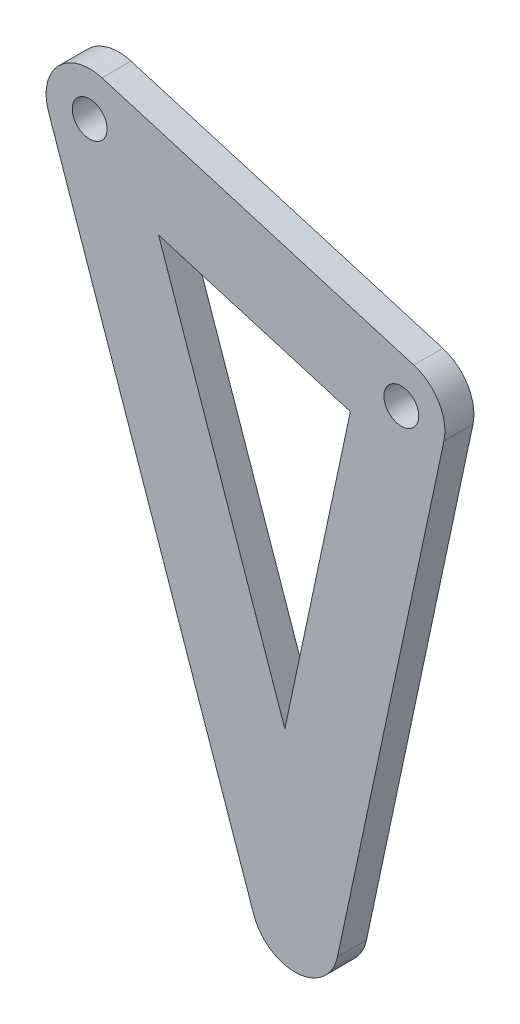
from build123d import *

# Parameters (mm, degrees)
BOSS_EXTRU_1_DEPTH           = 5
ENL_V_MAT_EXTRU_1_DEPTH      = 209.982344461
ENL_V_MAT_EXTRU_1_DEPTH_BACK = 209.982344461
ESQUISSE2_R                  = 3


with BuildPart() as part:
    # Esquisse1 → Boss.-Extru.1 (new body)
    with BuildSketch(Plane.XY):
        with BuildLine():
            ThreePointArc((-136.168332206, -32.884009695), (-143.727587426, -34.88617621), (-145.396458882, -42.525932639))
            Line((-145.396458882, -42.525932639), (-110.058903202, -144.581099871))
            ThreePointArc((-110.058903202, -144.581099871), (-102.508982864, -149.612813131), (-95.636285785, -143.689514194))
            Line((-95.636285785, -143.689514194), (-77.303993834, -57.620198687))
            ThreePointArc((-77.303993834, -57.620198687), (-78.190205637, -52.229303715), (-82.498484576, -48.86986142))
            Line((-82.498484576, -48.86986142), (-136.168332206, -32.884009695))
        make_face()
        Polygon((-126.438409435, -51.433365556), (-93.41759999, -61.268790602), (-104.696691434, -114.223635676), align=None, mode=Mode.SUBTRACT)
    extrude(amount=-BOSS_EXTRU_1_DEPTH)

    # Esquisse2 → Enlèv. mat.-Extru.1 (cut, two sides: drawn at the far end of the back side and taken through both)
    with BuildSketch(Plane.XY.offset(-ENL_V_MAT_EXTRU_1_DEPTH_BACK)):
        with Locations((-84.63944686, -56.057787441)):
            Circle(ESQUISSE2_R)
        with Locations((-138.309294491, -40.071935717)):
            Circle(ESQUISSE2_R)
    extrude(amount=ENL_V_MAT_EXTRU_1_DEPTH + ENL_V_MAT_EXTRU_1_DEPTH_BACK, mode=Mode.SUBTRACT)


solid = part.part
